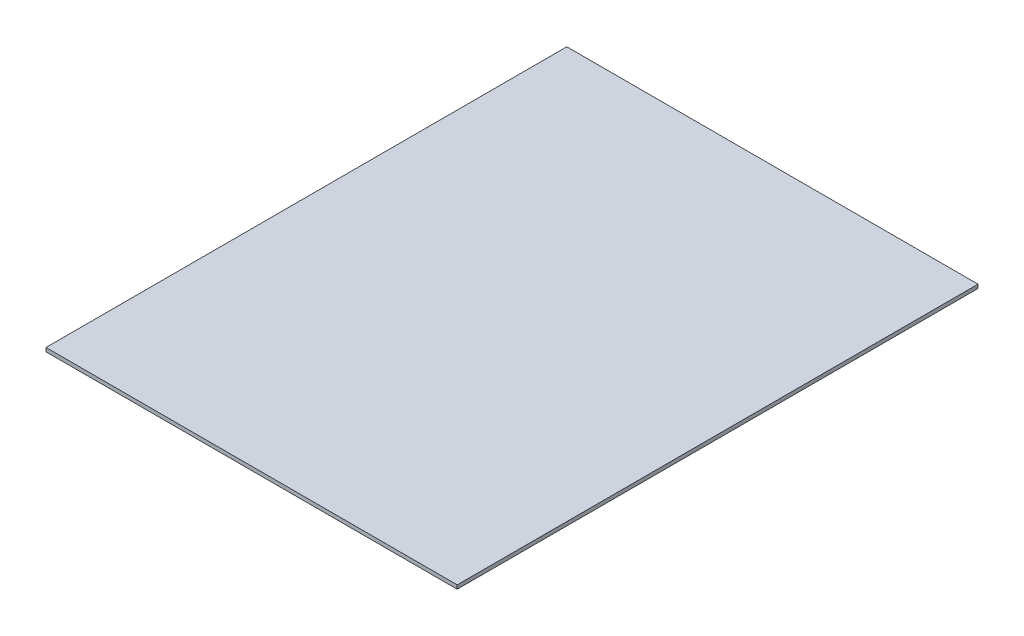
from build123d import *

# Parameters (mm, degrees)
SKETCH1_W           = 326
SKETCH1_H           = 412.9
BOSS_EXTRUDE1_DEPTH = 3


with BuildPart() as part:
    # Sketch1 → Boss-Extrude1 (new body)
    with BuildSketch(Plane(origin=(0, 0, 0), x_dir=(1, 0, 0), z_dir=(0, 1, 0))):
        Rectangle(SKETCH1_W, SKETCH1_H)
    extrude(amount=BOSS_EXTRUDE1_DEPTH)


solid = part.part
